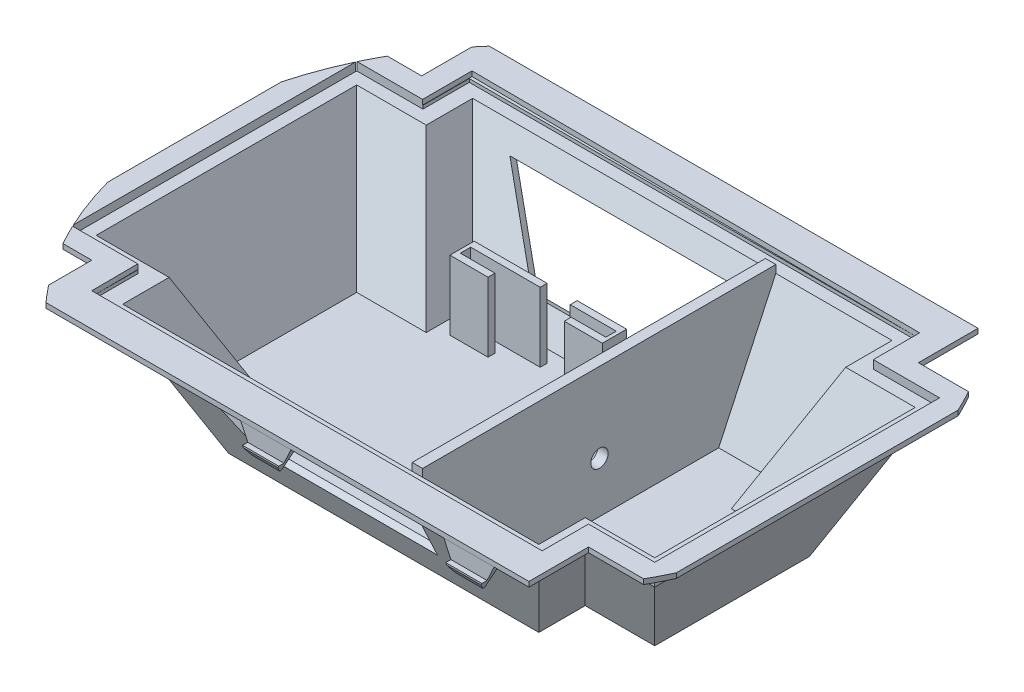
from build123d import *

# Parameters (mm, degrees)
SKETCH1_W             = 140
SKETCH1_H             = 14
SKETCH1_W_2           = 180
SKETCH1_H_2           = 90
BOSS_EXTRUDE1_DEPTH   = 3
BOSS_EXTRUDE2_DEPTH   = 40
BOSS_EXTRUDE2_DRAFT   = -25
SHELL1_T              = -2
BOSS_EXTRUDE4_DEPTH   = 1.5
SCALE1_SCALE          = 0.4777778
CUT_EXTRUDE3_START    = -10
CUT_EXTRUDE3_DEPTH    = 4
SNAP_START            = -31.975695848
SNAP_HOOK1_DEPTH      = 0.247222222
SNAP_START_2          = -6.313244992
SNAP_HOOK1_2_DEPTH    = 7.314130886
SNAP_START_3          = -5.262379505
SNAP_HOOK1_3_DEPTH    = 5.212399912
SNAP_START_4          = -34
SNAP_HOOK1_4_DEPTH    = 4
SKETCH16_W            = 5
SKETCH16_H            = 1
SKETCH16_W_2          = 0.5
SKETCH16_H_2          = 3.5
SKETCH16_W_3          = 10.020724484
SKETCH16_W_4          = 6.639207239
BOSS_EXTRUDE5_DEPTH   = 10
CUT_EXTRUDE8_DEPTH    = 3.5
BOSS_EXTRUDE9_DEPTH   = 1.5
MIRROR34_START        = -31.975695848
MIRROR34_COPY_1_DEPTH = 0.247222222
MIRROR34_START_2      = -6.313244992
MIRROR34_COPY_2_DEPTH = 7.314130886
MIRROR34_START_3      = -5.262379505
MIRROR34_COPY_3_DEPTH = 5.212399912
MIRROR34_START_4      = -34
MIRROR34_COPY_4_DEPTH = 4
MIRROR34_COPY_5_DEPTH = 7.314130886
MIRROR34_COPY_6_DEPTH = 5.212399912
MIRROR34_COPY_7_DEPTH = 4
SKETCH32_R            = 1.25
CUT_EXTRUDE9_DEPTH    = 3


with BuildPart() as part:
    # Sketch1 → Boss-Extrude1 (new body)
    with BuildSketch(Plane(origin=(0, 0, 0), x_dir=(1, 0, 0), z_dir=(0, 1, 0))):
        with Locations((0, -52)):
            Rectangle(SKETCH1_W, SKETCH1_H)
        Rectangle(SKETCH1_W_2, SKETCH1_H_2)
        with Locations((0, 52)):
            Rectangle(SKETCH1_W, SKETCH1_H)
    extrude(amount=BOSS_EXTRUDE1_DEPTH)


with BuildPart() as boss_extrude2_tool:
    # Sketch2 → Boss-Extrude2 (with draft: the straight prism first)
    with BuildSketch(Plane(origin=(0, 3, 0), x_dir=(1, 0, 0), z_dir=(0, 1, 0))):
        Polygon((87, -42), (87, 42), (66, 42), (66, 56), (-66, 56), (-66, 42), (-87, 42), (-87, -42), (-65, -42), (-65, -56), (66, -56), (66, -42), align=None)
    extrude(amount=-BOSS_EXTRUDE2_DEPTH)
    # Boss-Extrude2: the draft: its side faces are tilted about the plane it starts from
    boss_extrude2_sides = [boss_extrude2_tool.faces().sort_by_distance(p)[0] for p in [
        (87, -17, 0),
        (76.5, -17, -42),
        (66, -17, -49),
        (0, -17, -56),
        (-66, -17, -49),
        (-76.5, -17, -42),
        (-87, -17, 0),
        (-76, -17, 42),
        (-65, -17, 49),
        (0.5, -17, 56),
        (66, -17, 49),
        (76.5, -17, 42),
    ]]
    draft(boss_extrude2_sides, Plane(origin=(0, 3, 0), x_dir=(1, 0, 0), z_dir=(0, 1, 0)), BOSS_EXTRUDE2_DRAFT)


with BuildPart() as part_1:
    add(part.part)

    # Boss-Extrude2: add boss_extrude2_tool
    add(boss_extrude2_tool.part)

    # Shell1
    shell1_openings = [part_1.faces().sort_by_distance(p)[0] for p in [
        (0, 3, 0),
    ]]
    offset(amount=SHELL1_T, openings=shell1_openings, kind=Kind.INTERSECTION)

    # Sketch6 → Boss-Extrude4 (add)
    with BuildSketch(Plane(origin=(0, 3, 0), x_dir=(1, 0, 0), z_dir=(0, 1, 0))):
        Polygon((94, 49), (75.612106054, 49), (75.612106054, 67), (-74.387893946, 67), (-74.387893946, 49), (-94, 49), (-94, -49), (-76, -49), (-76, -67), (74, -67), (74, -49), (94, -49), align=None)
        Polygon((88, -43), (88, 43), (68, 43), (68, 57), (-68.106730885, 57.932601668), (-68.106730885, 43), (-88, 43), (-88, -43), (-68.106730885, -43), (-68, -57), (68, -57), (68, -43), align=None, mode=Mode.SUBTRACT)
    extrude(amount=BOSS_EXTRUDE4_DEPTH)


with BuildPart() as part_2:
    # Scale1: scaled about (0.020709859, -17.532954153, 0.067819315)
    add(part_1.part.scale(SCALE1_SCALE).moved(Location((0.010815148, -9.15609789, 0.035416752))))

    # Cut-Extrude3: read off the stored shape, not the designer's step
    # Cut-Extrude3 outline → Cut-Extrude3 (cut)
    with BuildSketch(Plane(origin=(0, 0, 0), x_dir=(1, 0, 0), z_dir=(0, 1, 0)).offset(CUT_EXTRUDE3_START)):
        with BuildLine():
            ThreePointArc((-34.301389296, -32.046529352), (-35.32011541, -30.872581639), (-36.300297652, -29.666265387))
            Line((-36.300297652, -29.666265387), (-36.300297652, -32.046529352))
            Line((-36.300297652, -32.046529352), (-34.301389296, -32.046529352))
        make_face()
        with BuildLine():
            Line((-40.483605991, 23.375695448), (-44.900298052, 23.375695448))
            Line((-44.900298052, 23.375695448), (-44.900298052, 12.517856629))
            ThreePointArc((-44.900298052, 12.517856629), (-43.024636929, 18.082103779), (-40.483605991, 23.375695448))
        make_face()
        with BuildLine():
            Line((-35.530069168, 31.975695848), (-35.530069168, 30.612812124))
            ThreePointArc((-35.530069168, 30.612812124), (-34.950219267, 31.299743697), (-34.35760676, 31.975695848))
            Line((-34.35760676, 31.975695848), (-35.530069168, 31.975695848))
        make_face()
        with BuildLine():
            Line((-44.900298052, -12.525876421), (-44.900298052, -23.446528952))
            Line((-44.900298052, -23.446528952), (-40.448512682, -23.446528952))
            ThreePointArc((-40.448512682, -23.446528952), (-43.011068882, -18.123442994), (-44.900298052, -12.525876421))
        make_face()
        with BuildLine():
            Line((44.921928348, -23.446528952), (44.921928348, -20.329243571))
            ThreePointArc((44.921928348, -20.329243571), (44.151290065, -21.90247063), (43.3237572, -23.446528952))
            Line((43.3237572, -23.446528952), (44.921928348, -23.446528952))
        make_face()
        with BuildLine():
            ThreePointArc((43.35885051, 23.375695448), (44.167690984, 21.862430755), (44.921928348, 20.321223779))
            Line((44.921928348, 20.321223779), (44.921928348, 23.375695448))
            Line((44.921928348, 23.375695448), (43.35885051, 23.375695448))
        make_face()
    extrude(amount=CUT_EXTRUDE3_DEPTH, mode=Mode.SUBTRACT)



with BuildPart() as body_2:
    # Snap Hook1: read off the stored shape, not the designer's step
    # Snap Hook1 outline → Snap Hook1 (new body)
    with BuildSketch(Plane.XY.offset(SNAP_START)):
        Polygon((-5.262379505, -9.9763528), (-4.656179549, -11.2763528), (-0.656179549, -11.2763528), (-0.049979593, -9.9763528), align=None)
    snap_hook1 = extrude(amount=SNAP_HOOK1_DEPTH)


with BuildPart() as part_3:
    add(part_2.part)

    add(body_2.part)  # Snap Hook1 2 merges body 2
    # Snap Hook1 2 outline → Snap Hook1 2 (add)
    with BuildSketch(Plane.YZ.offset(SNAP_START_2)):
        Polygon((-9.9763528, -31.975695848), (-7.72276449, -31.975695848), (-7.72276449, -31.037498121), (-11.2763528, -31.728473626), (-9.9763528, -31.728473626), align=None)
    snap_hook1_2 = extrude(amount=SNAP_HOOK1_2_DEPTH)

    # Snap Hook1 3 outline → Snap Hook1 3 (add)
    with BuildSketch(Plane.YZ.offset(SNAP_START_3)):
        Polygon((-9.9763528, -32.725695848), (-9.9763528, -31.975695848), (-11.2763528, -31.975695848), (-10.2263528, -32.725695848), align=None)
    snap_hook1_3 = extrude(amount=SNAP_HOOK1_3_DEPTH)

    # Snap Hook1 4 outline → Snap Hook1 4 (cut)
    with BuildSketch(Plane.XY.offset(SNAP_START_4)):
        Polygon((-6.313244992, -7.72276449), (-6.313244992, -13), (-3.85242966, -13), (-4.656179549, -11.2763528), align=None)
        Polygon((-0.656179549, -11.2763528), (-1.459929438, -13), (1.000885894, -13), (1.000885894, -7.72276449), align=None)
    snap_hook1_4 = extrude(amount=SNAP_HOOK1_4_DEPTH, mode=Mode.SUBTRACT)

    # Sketch16 → Boss-Extrude5 (add)
    with BuildSketch(Plane(origin=(0, -25.87832089, 0), x_dir=(1, 0, 0), z_dir=(0, 1, 0))):
        with Locations((-16.965194138, 12.3890301)):
            Rectangle(SKETCH16_W, SKETCH16_H)
        with Locations((-19.715194138, 13.6390301)):
            Rectangle(SKETCH16_W_2, SKETCH16_H_2)
        with Locations((-14.454831896, 14.8890301)):
            Rectangle(SKETCH16_W_3, SKETCH16_H)
        with Locations((-0.965194138, 12.3890301)):
            Rectangle(SKETCH16_W, SKETCH16_H)
        with Locations((-1.784797758, 14.8890301)):
            Rectangle(SKETCH16_W_4, SKETCH16_H)
        Polygon((2.034805862, 15.3890301), (1.534805862, 15.3890301), (1.534805862, 14.3890301), (1.534805862, 12.8890301), (1.534805862, 11.8890301), (2.034805862, 11.8890301), align=None)
    extrude(amount=BOSS_EXTRUDE5_DEPTH)

    # Mirror17: Snap Hook1, Snap Hook1 2, Snap Hook1 3, Snap Hook1 4 across plane
    add(snap_hook1.mirror(Plane.XY))
    add(snap_hook1_2.mirror(Plane.XY))
    add(snap_hook1_3.mirror(Plane.XY))
    add(snap_hook1_4.mirror(Plane.XY), mode=Mode.SUBTRACT)

    # Sketch28 → Cut-Extrude8 (cut, symmetric)
    with BuildSketch(Plane(origin=(0, -11.613740983, -24.905747912), x_dir=(-1, 0, 0), z_dir=(0, -0.42261826174070033, -0.9063077870366497))):
        Polygon((23.440057223, -0.056353665), (15.221105561, -11.884805387), (-10.068654735, -11.884805387), (-10.068654735, -0.056353665), align=None)
    cut_extrude8 = extrude(amount=CUT_EXTRUDE8_DEPTH, both=True, mode=Mode.SUBTRACT)

    # Mirror33: Cut-Extrude8 across plane
    add(cut_extrude8.mirror(Plane.XY), mode=Mode.SUBTRACT)

    # Sketch31 → Boss-Extrude9 (add)
    with BuildSketch(Plane(origin=(12, 0, 0), x_dir=(0, 0, -1), z_dir=(1, 0, 0))):
        Polygon((-25.513843155, -8.20054229), (-17.270559615, -25.87832089), (17.199726111, -25.87832089), (25.443009652, -8.20054229), (25.443009652, -7.091787122), (-25.513843155, -7.091787122), align=None)
    extrude(amount=BOSS_EXTRUDE9_DEPTH)

    # Mirror34: Snap Hook1, Snap Hook1 2, Snap Hook1 3, Snap Hook1 4 across plane
    add(snap_hook1.mirror(Plane(origin=(12, 0, 0), x_dir=(0, 0, 1), z_dir=(1, 0, 0))))
    add(snap_hook1_2.mirror(Plane(origin=(12, 0, 0), x_dir=(0, 0, 1), z_dir=(1, 0, 0))))
    add(snap_hook1_3.mirror(Plane(origin=(12, 0, 0), x_dir=(0, 0, 1), z_dir=(1, 0, 0))))
    add(snap_hook1_4.mirror(Plane(origin=(12, 0, 0), x_dir=(0, 0, 1), z_dir=(1, 0, 0))), mode=Mode.SUBTRACT)



with BuildPart() as body_2_2:
    # Mirror34 copy 1 sketch → Mirror34 copy 1 (new body)
    with BuildSketch(Plane(origin=(24, 0, 0), x_dir=(-1, 0, 0), z_dir=(0, 0, -1)).offset(MIRROR34_START)):
        Polygon((-5.262379505, -9.9763528), (-4.656179549, -11.2763528), (-0.656179549, -11.2763528), (-0.049979593, -9.9763528), align=None)
    extrude(amount=MIRROR34_COPY_1_DEPTH)


with BuildPart() as part_4:
    add(part_3.part)

    add(body_2_2.part)  # Mirror34 copy 2 merges body 2 2
    # Mirror34 copy 2 sketch → Mirror34 copy 2 (add)
    with BuildSketch(Plane(origin=(24, 0, 0), x_dir=(0, 1, 0), z_dir=(-1, 0, 0)).offset(MIRROR34_START_2)):
        Polygon((-9.9763528, -31.975695848), (-7.72276449, -31.975695848), (-7.72276449, -31.037498121), (-11.2763528, -31.728473626), (-9.9763528, -31.728473626), align=None)
    extrude(amount=MIRROR34_COPY_2_DEPTH)

    # Mirror34 copy 3 sketch → Mirror34 copy 3 (add)
    with BuildSketch(Plane(origin=(24, 0, 0), x_dir=(0, 1, 0), z_dir=(-1, 0, 0)).offset(MIRROR34_START_3)):
        Polygon((-9.9763528, -32.725695848), (-9.9763528, -31.975695848), (-11.2763528, -31.975695848), (-10.2263528, -32.725695848), align=None)
    extrude(amount=MIRROR34_COPY_3_DEPTH)

    # Mirror34 copy 4 sketch → Mirror34 copy 4 (cut)
    with BuildSketch(Plane(origin=(24, 0, 0), x_dir=(-1, 0, 0), z_dir=(0, 0, -1)).offset(MIRROR34_START_4)):
        Polygon((-6.313244992, -7.72276449), (-6.313244992, -13), (-3.85242966, -13), (-4.656179549, -11.2763528), align=None)
        Polygon((-0.656179549, -11.2763528), (-1.459929438, -13), (1.000885894, -13), (1.000885894, -7.72276449), align=None)
    extrude(amount=MIRROR34_COPY_4_DEPTH, mode=Mode.SUBTRACT)

    # Mirror34 copy 5 sketch → Mirror34 copy 5 (add)
    with BuildSketch(Plane(origin=(24, 0, 0), x_dir=(0, 1, 0), z_dir=(-1, 0, 0)).offset(MIRROR34_START_2)):
        Polygon((-9.9763528, 31.975695848), (-7.72276449, 31.975695848), (-7.72276449, 31.037498121), (-11.2763528, 31.728473626), (-9.9763528, 31.728473626), align=None)
    extrude(amount=MIRROR34_COPY_5_DEPTH)

    # Mirror34 copy 6 sketch → Mirror34 copy 6 (add)
    with BuildSketch(Plane(origin=(24, 0, 0), x_dir=(0, 1, 0), z_dir=(-1, 0, 0)).offset(MIRROR34_START_3)):
        Polygon((-9.9763528, 32.725695848), (-9.9763528, 31.975695848), (-11.2763528, 31.975695848), (-10.2263528, 32.725695848), align=None)
    extrude(amount=MIRROR34_COPY_6_DEPTH)

    # Mirror34 copy 7 sketch → Mirror34 copy 7 (cut)
    with BuildSketch(Plane(origin=(24, 0, 0), x_dir=(-1, 0, 0), z_dir=(0, 0, 1)).offset(MIRROR34_START_4)):
        Polygon((-6.313244992, 7.72276449), (-6.313244992, 13), (-3.85242966, 13), (-4.656179549, 11.2763528), align=None)
        Polygon((-0.656179549, 11.2763528), (-1.459929438, 13), (1.000885894, 13), (1.000885894, 7.72276449), align=None)
    extrude(amount=MIRROR34_COPY_7_DEPTH, mode=Mode.SUBTRACT)

    # Sketch32 → Cut-Extrude9 (cut)
    with BuildSketch(Plane(origin=(13.5, 0, 0), x_dir=(0, 0, -1), z_dir=(1, 0, 0))):
        with Locations((0, -18.57832089)):
            Circle(SKETCH32_R)
    extrude(amount=-CUT_EXTRUDE9_DEPTH, mode=Mode.SUBTRACT)


solid = part_4.part
